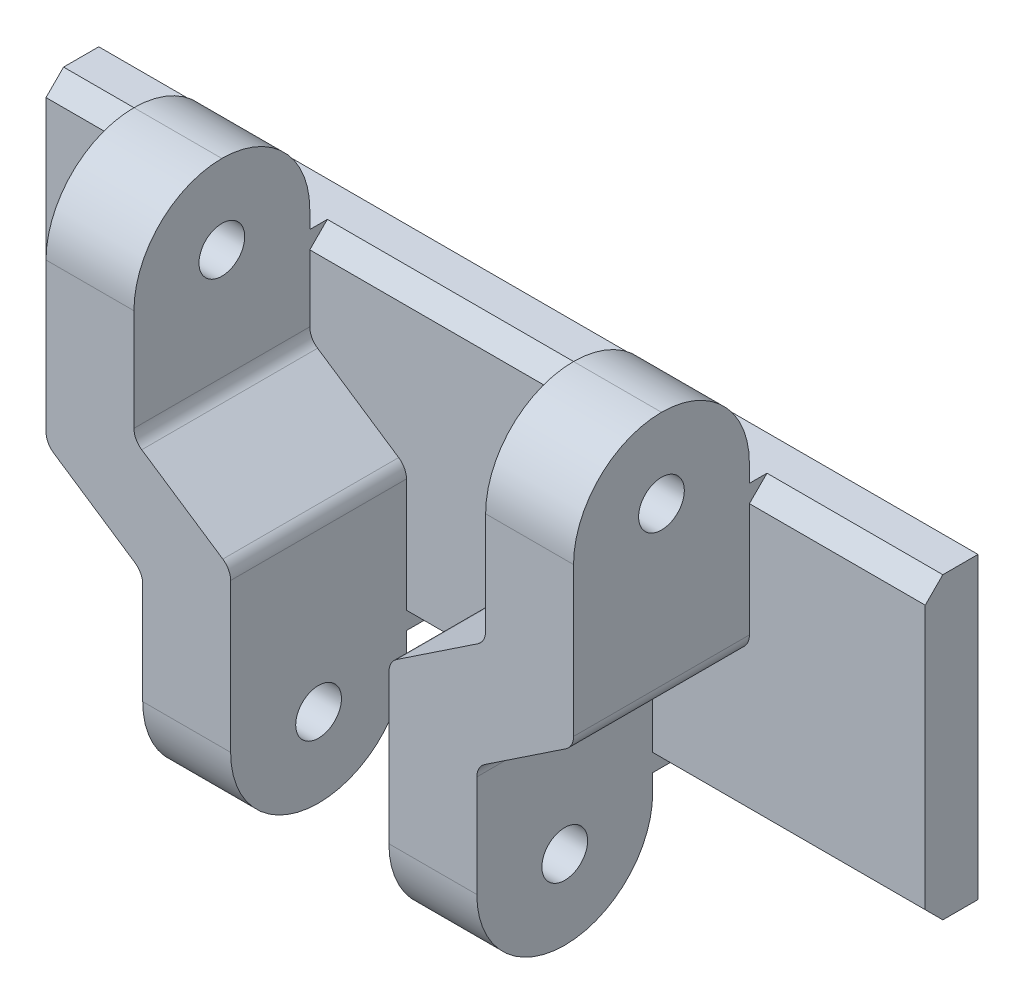
from build123d import *

# Parameters (mm, degrees)
ESQUISSE1_W                     = 50
ESQUISSE1_H                     = 17
BOSS_EXTRU_1_DEPTH              = 3
BOSS_EXTRU_2_DEPTH              = 10
CONG_1_R                        = 5
CONG_2_R                        = 1
CHANFREIN1_SIZE                 = 1
DIAM_TRE_DU_PER_AGE_2_6_2_6_1_D = 2.6


with BuildPart() as part:
    # Esquisse1 → Boss.-Extru.1 (new body)
    with BuildSketch(Plane.XY):
        Rectangle(ESQUISSE1_W, ESQUISSE1_H)
    extrude(amount=BOSS_EXTRU_1_DEPTH)

    # Esquisse2 → Boss.-Extru.2 (add)
    with BuildSketch(Plane.XY.offset(3)):
        Polygon((-15, 14.5), (-15, 0.5), (-9.5, -3.173254132), (-9.5, -14.5), (-4.5, -14.5), (-4.5, -0.5), (-10, 3.173254132), (-10, 14.5), align=None)
        Polygon((10, 14.5), (15, 14.5), (15, 0.5), (9.5, -3.173254132), (9.5, -14.5), (4.5, -14.5), (4.5, -0.5), (10, 3.173254132), align=None)
    extrude(amount=BOSS_EXTRU_2_DEPTH)

    # Congé1
    cong_1_edges = [part.edges().sort_by_distance(p)[0] for p in [
        (7, -14.5, 13),
        (7, -14.5, 3),
        (-7, -14.5, 3),
        (-7, -14.5, 13),
        (-12.5, 14.5, 13),
        (12.5, 14.5, 13),
        (12.5, 14.5, 3),
        (-12.5, 14.5, 3),
    ]]
    fillet(cong_1_edges, radius=CONG_1_R - 0.0001)  # a hair under: the kernel refuses the full size

    # Congé2
    cong_2_edges = [part.edges().sort_by_distance(p)[0] for p in [
        (-15, 0.5, 8),
        (-9.5, -3.173254132, 8),
        (-4.5, -0.5, 8),
        (-10, 3.173254132, 8),
        (10, 3.173254132, 8),
        (4.5, -0.5, 8),
        (9.5, -3.173254132, 8),
        (15, 0.5, 8),
    ]]
    fillet(cong_2_edges, radius=CONG_2_R)

    # Chanfrein1
    chanfrein1_edges = [part.edges().sort_by_distance(p)[0] for p in [
        (-17.25, -8.5, 3),
        (-20, 8.5, 3),
        (0, -8.5, 3),
        (17.25, -8.5, 3),
        (0, 8.5, 3),
        (20, 8.5, 3),
    ]]
    chamfer(chanfrein1_edges, length=CHANFREIN1_SIZE)

    # Diamètre du perçage Ø2.6 (2.6)1 (through all)
    with Locations(Plane(origin=(15, 0, 0), x_dir=(0, 0, -1), z_dir=(1, 0, 0))):
        with Locations((-8, -10), (-8, 10)):
            Hole(DIAM_TRE_DU_PER_AGE_2_6_2_6_1_D / 2)


solid = part.part
